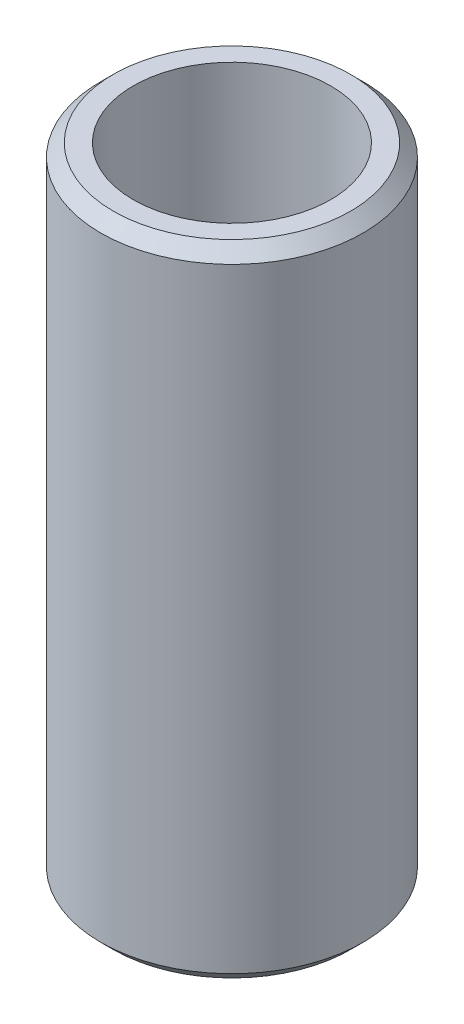
from build123d import *

# Parameters (mm, degrees)
SKETCH1_R           = 57.5
BOSS_EXTRUDE1_DEPTH = 280.298555757
SKETCH2_R           = 43.254745997
CUT_EXTRUDE1_DEPTH  = 292.855752658
CHAMFER1_SIZE       = 5.521252273


with BuildPart() as part:
    # Sketch1 → Boss-Extrude1 (new body)
    with BuildSketch(Plane(origin=(0, 0, 0), x_dir=(1, 0, 0), z_dir=(0, 1, 0))):
        Circle(SKETCH1_R)
    extrude(amount=BOSS_EXTRUDE1_DEPTH)

    # Sketch2 → Cut-Extrude1 (cut, through all)
    with BuildSketch(Plane(origin=(0, 0, 0), x_dir=(1, 0, 0), z_dir=(0, 1, 0))):
        Circle(SKETCH2_R)
    extrude(amount=CUT_EXTRUDE1_DEPTH, mode=Mode.SUBTRACT)

    # Chamfer1
    chamfer1_edges = [part.edges().sort_by_distance(p)[0] for p in [
        (-57.5, 280.298555757, 0),
        (-57.5, 0, 0),
    ]]
    chamfer(chamfer1_edges, length=CHAMFER1_SIZE)


solid = part.part
